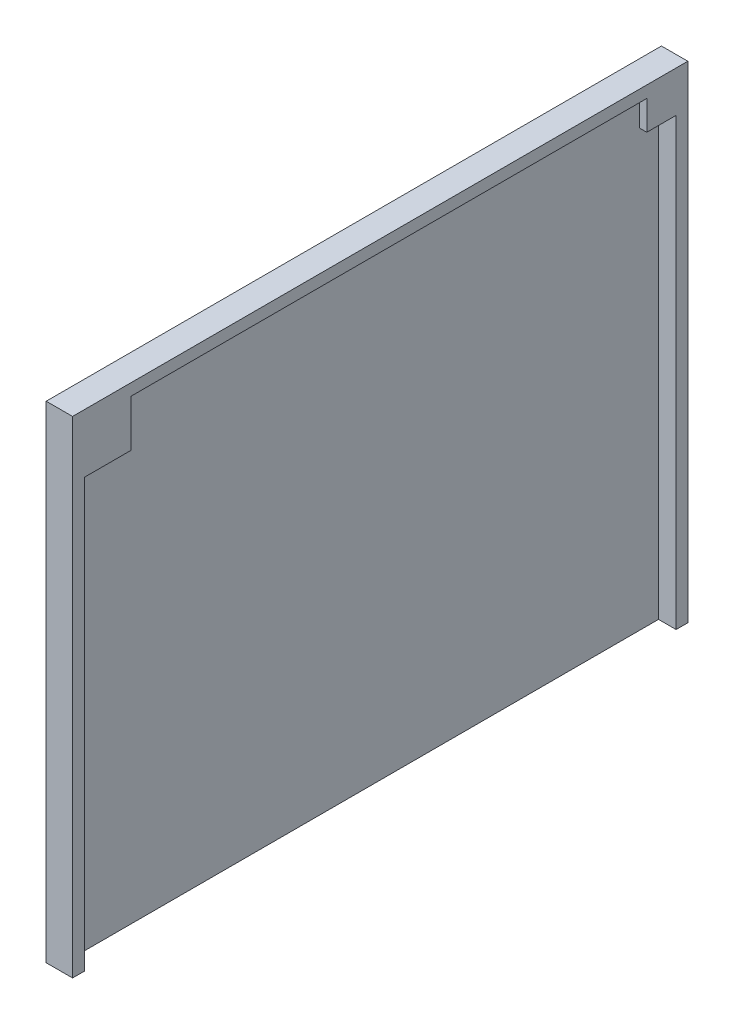
from build123d import *

# Parameters (mm, degrees)
SKETCH6_W           = 105
SKETCH6_H           = 83
BOSS_EXTRUDE3_DEPTH = 4.5
SKETCH9_W           = 3
SKETCH9_H           = 101
CUT_EXTRUDE6_DEPTH  = 81
SKETCH10_W          = 1
SKETCH10_H          = 8
BOSS_EXTRUDE4_DEPTH = 8
SKETCH11_W          = 1.226225524
SKETCH11_H          = 5
BOSS_EXTRUDE5_DEPTH = 5


with BuildPart() as part:
    # Sketch6 → Boss-Extrude3 (new body)
    with BuildSketch(Plane(origin=(0, 0, 0), x_dir=(0, 0, -1), z_dir=(1, 0, 0))):
        with Locations((52.5, -41.5)):
            Rectangle(SKETCH6_W, SKETCH6_H)
    extrude(amount=BOSS_EXTRUDE3_DEPTH)

    # Sketch9 → Cut-Extrude6 (cut)
    with BuildSketch(Plane.XZ.offset(83)):
        with Locations((3, -52.5)):
            Rectangle(SKETCH9_W, SKETCH9_H)
    extrude(amount=-CUT_EXTRUDE6_DEPTH, mode=Mode.SUBTRACT)

    # Sketch10 → Boss-Extrude4 (add)
    with BuildSketch(Plane(origin=(0, 0, -2), x_dir=(-1, 0, 0), z_dir=(0, 0, -1))):
        with Locations((-4, -6)):
            Rectangle(SKETCH10_W, SKETCH10_H)
    extrude(amount=BOSS_EXTRUDE4_DEPTH)

    # Sketch11 → Boss-Extrude5 (add)
    with BuildSketch(Plane.XY.offset(-103)):
        with Locations((3.886887238, -4.5)):
            Rectangle(SKETCH11_W, SKETCH11_H)
    extrude(amount=BOSS_EXTRUDE5_DEPTH)


solid = part.part
